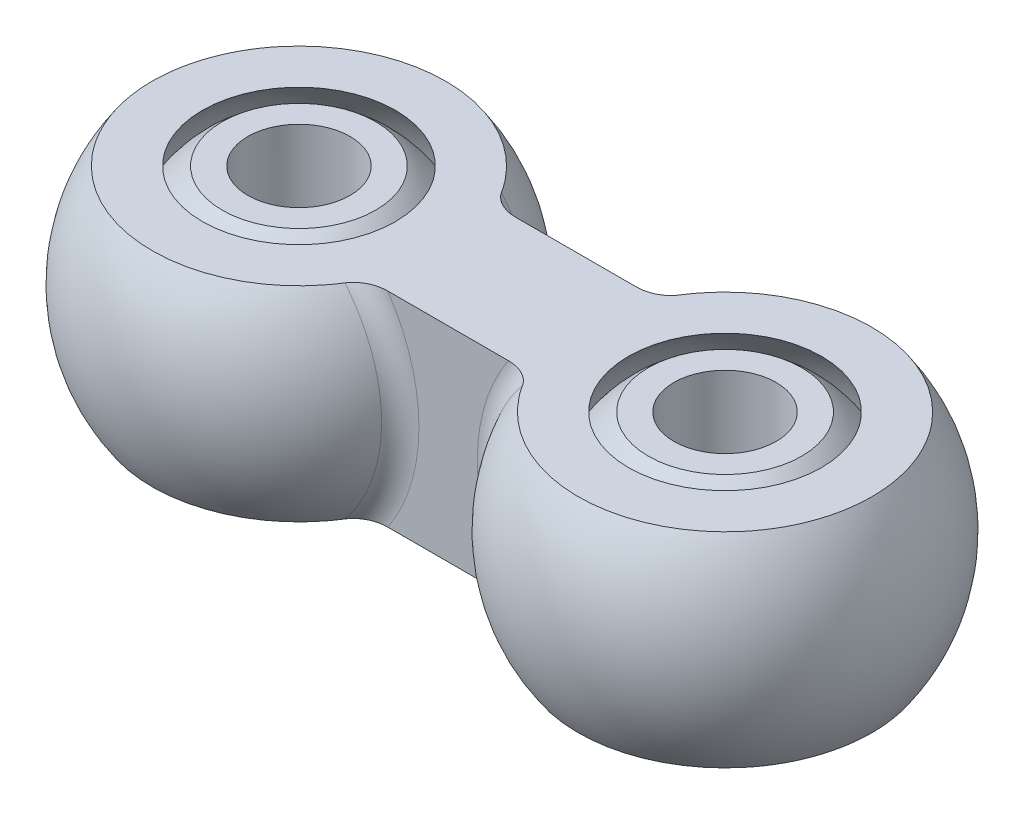
from build123d import *

# Parameters (mm, degrees)
CORTAR_EXTRUIR1_DEPTH                    = 10
SALIENTE_EXTRUIR1_REACH                  = 19.325
SALIENTE_EXTRUIR1_END_RADIUS             = 7
CROQUIS3_W                               = 5
CROQUIS3_H                               = 8
SALIENTE_EXTRUIR1_DIRECTION_2_REACH      = 19.325
SALIENTE_EXTRUIR1_DIRECTION_2_END_RADIUS = 7
CROQUIS4_R                               = 2
CORTAR_EXTRUIR3_DEPTH                    = 5
REDONDEO1_R                              = 1


with BuildPart() as part:
    # Croquis1 → Revolución1 (revolve)
    with BuildSketch(Plane.XY):
        with BuildLine():
            Line((-13.335, 0), (-3.335, 0))
            ThreePointArc((-3.335, 0), (-8.335, 5), (-13.335, 0))
        make_face()
        with BuildLine():
            Line((-13.835, 0), (-15.335, 0))
            ThreePointArc((-15.335, 0), (-8.335, 7), (-1.335, 0))
            Line((-1.335, 0), (-2.835, 0))
            ThreePointArc((-2.835, 0), (-8.335, 5.5), (-13.835, 0))
        make_face()
        with BuildLine():
            Line((2.835, 0), (1.335, 0))
            ThreePointArc((1.335, 0), (8.335, 7), (15.335, 0))
            Line((15.335, 0), (13.835, 0))
            ThreePointArc((13.835, 0), (8.335, 5.5), (2.835, 0))
        make_face()
        with BuildLine():
            Line((13.335, 0), (3.335, 0))
            ThreePointArc((3.335, 0), (8.335, 5), (13.335, 0))
        make_face()
    revolve(axis=Axis((-8.335, 0, 0), (1, 0, 0)))

    # Croquis2 → Cortar-Extruir1 (cut, symmetric)
    with BuildSketch(Plane.XY):
        Polygon((0, 4), (-15, 4), (-15, 9), (15, 9), (15, 4), align=None)
        Polygon((15, -9), (15, -4), (0, -4), (-15, -4), (-15, -9), align=None)
    extrude(amount=CORTAR_EXTRUIR1_DEPTH, both=True, mode=Mode.SUBTRACT)

    # Saliente-Extruir1: up to this sphere (the profile starts outside it)
    saliente_extruir1_end = Location((8.335, 0, 0)) * Sphere(SALIENTE_EXTRUIR1_END_RADIUS, mode=Mode.PRIVATE)
    # Croquis3 → Saliente-Extruir1 (add, up to the surface)
    with BuildSketch(Plane(origin=(0, 0, 0), x_dir=(0, 0, -1), z_dir=(1, 0, 0)), mode=Mode.PRIVATE) as saliente_extruir1_sk1:
        Rectangle(CROQUIS3_W, CROQUIS3_H)
    saliente_extruir1_tool1 = extrude(saliente_extruir1_sk1.sketch, amount=SALIENTE_EXTRUIR1_REACH, mode=Mode.PRIVATE) - saliente_extruir1_end
    add(saliente_extruir1_tool1.solids().sort_by_distance((0, 0, 0))[0])

    # Saliente-Extruir1 direction 2: up to this sphere (the profile starts outside it)
    saliente_extruir1_direction_2_end = Location((-8.335, 0, 0)) * Sphere(SALIENTE_EXTRUIR1_DIRECTION_2_END_RADIUS, mode=Mode.PRIVATE)
    # Croquis3 → Saliente-Extruir1 direction 2 (add, up to the surface)
    with BuildSketch(Plane(origin=(0, 0, 0), x_dir=(0, 0, -1), z_dir=(1, 0, 0)), mode=Mode.PRIVATE) as saliente_extruir1_direction_2_sk1:
        Rectangle(CROQUIS3_W, CROQUIS3_H)
    saliente_extruir1_direction_2_tool1 = extrude(saliente_extruir1_direction_2_sk1.sketch, amount=-SALIENTE_EXTRUIR1_DIRECTION_2_REACH, mode=Mode.PRIVATE) - saliente_extruir1_direction_2_end
    add(saliente_extruir1_direction_2_tool1.solids().sort_by_distance((0, 0, 0))[0])

    # Croquis4 → Cortar-Extruir3 (cut, symmetric)
    with BuildSketch(Plane(origin=(0, 0, 0), x_dir=(1, 0, 0), z_dir=(0, 1, 0))):
        with Locations(Location((-8.335, 0, 0), (0, 0, 180))):
            Circle(CROQUIS4_R)
        with Locations(Location((8.335, 0, 0), (0, 0, 180))):
            Circle(CROQUIS4_R)
    extrude(amount=CORTAR_EXTRUIR3_DEPTH, both=True, mode=Mode.SUBTRACT)

    # Redondeo1
    # the kernel refuses this fillet: 1 mm, written as the material it adds along each edge
    with BuildSketch(Plane(origin=(-8.335, 0, 2.5), x_dir=(0.6145573039832218, 0.7888721823723244, 0), z_dir=(-0.7888721823723244, 0.6145573039832218, 0))) as redondeo1_piece_1_section:
        with BuildLine():
            CenterArc((7.193747285, -1), REDONDEO1_R, 90, 64.055520228)
            ThreePointArc((6.294528874, -0.5625), (6.422599664, -0.283920537), (6.538348415, 0))
            Line((6.538348415, 0), (7.193747285, 0))
        make_face()
    redondeo1_piece_1 = revolve(axis=Axis((-8.335, 0, 2.5), (0, 0, -1)), revolution_arc=104.160479503, mode=Mode.PRIVATE)
    redondeo1_piece_1 = split(redondeo1_piece_1, bisect_by=Plane(origin=(-1.676585833, -4, 2.644210853), z_dir=(0, 1, 0)), keep=Keep.TOP, mode=Mode.PRIVATE)
    redondeo1_piece_1 = split(redondeo1_piece_1, bisect_by=Plane(origin=(-1.676585833, 4, 2.644210853), z_dir=(0, -1, 0)), keep=Keep.TOP, mode=Mode.PRIVATE)
    add(redondeo1_piece_1)
    with BuildSketch(Plane(origin=(-8.335, 0, -2.5), x_dir=(0.6145573039832218, 0.7888721823723244, 0), z_dir=(-0.7888721823723244, 0.6145573039832218, 0))) as redondeo1_piece_2_section:
        with BuildLine():
            CenterArc((7.193747285, 1), REDONDEO1_R, 205.944479772, 64.055520228)
            ThreePointArc((6.294528874, 0.5625), (6.422599664, 0.283920537), (6.538348415, 0))
            Line((6.538348415, 0), (7.193747285, 0))
        make_face()
    redondeo1_piece_2 = revolve(axis=Axis((-8.335, 0, -2.5), (0, 0, -1)), revolution_arc=104.160479503, mode=Mode.PRIVATE)
    redondeo1_piece_2 = split(redondeo1_piece_2, bisect_by=Plane(origin=(-1.676585833, 4, -2.644210853), z_dir=(0, -1, 0)), keep=Keep.TOP, mode=Mode.PRIVATE)
    redondeo1_piece_2 = split(redondeo1_piece_2, bisect_by=Plane(origin=(-1.676585833, -4, -2.644210853), z_dir=(0, 1, 0)), keep=Keep.TOP, mode=Mode.PRIVATE)
    add(redondeo1_piece_2)
    with BuildSketch(Plane(origin=(8.335, 0, 2.5), x_dir=(-0.6145573039832218, 0.7888721823723245, 0), z_dir=(0.7888721823723245, 0.6145573039832218, 0))) as redondeo1_piece_3_section:
        with BuildLine():
            CenterArc((7.193747285, 1), REDONDEO1_R, 205.944479772, 64.055520228)
            ThreePointArc((6.294528874, 0.5625), (6.422599664, 0.283920537), (6.538348415, 0))
            Line((6.538348415, 0), (7.193747285, 0))
        make_face()
    redondeo1_piece_3 = revolve(axis=Axis((8.335, 0, 2.5), (0, 0, 1)), revolution_arc=104.160479503, mode=Mode.PRIVATE)
    redondeo1_piece_3 = split(redondeo1_piece_3, bisect_by=Plane(origin=(1.676585833, -4, 2.644210853), z_dir=(0, 1, 0)), keep=Keep.TOP, mode=Mode.PRIVATE)
    redondeo1_piece_3 = split(redondeo1_piece_3, bisect_by=Plane(origin=(1.676585833, 4, 2.644210853), z_dir=(0, -1, 0)), keep=Keep.TOP, mode=Mode.PRIVATE)
    add(redondeo1_piece_3)
    with BuildSketch(Plane(origin=(8.335, 0, -2.5), x_dir=(-0.6145573039832218, 0.7888721823723245, 0), z_dir=(0.7888721823723245, 0.6145573039832218, 0))) as redondeo1_piece_4_section:
        with BuildLine():
            CenterArc((7.193747285, -1), REDONDEO1_R, 90, 64.055520228)
            ThreePointArc((6.294528874, -0.5625), (6.422599664, -0.283920537), (6.538348415, 0))
            Line((6.538348415, 0), (7.193747285, 0))
        make_face()
    redondeo1_piece_4 = revolve(axis=Axis((8.335, 0, -2.5), (0, 0, 1)), revolution_arc=104.160479503, mode=Mode.PRIVATE)
    redondeo1_piece_4 = split(redondeo1_piece_4, bisect_by=Plane(origin=(1.676585833, 4, -2.644210853), z_dir=(0, -1, 0)), keep=Keep.TOP, mode=Mode.PRIVATE)
    redondeo1_piece_4 = split(redondeo1_piece_4, bisect_by=Plane(origin=(1.676585833, -4, -2.644210853), z_dir=(0, 1, 0)), keep=Keep.TOP, mode=Mode.PRIVATE)
    add(redondeo1_piece_4)


solid = part.part
